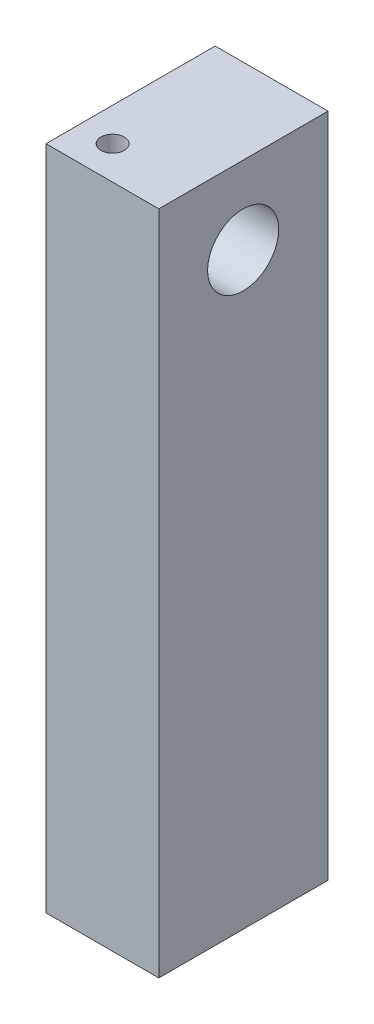
from build123d import *

# Parameters (mm, degrees)
SKETCH1_W           = 50.8
SKETCH1_H           = 76.2
BOSS_EXTRUDE1_DEPTH = 300
SKETCH2_R           = 16
CUT_EXTRUDE1_DEPTH  = 150
SKETCH4_R           = 5.25
CUT_EXTRUDE3_DEPTH  = 50


with BuildPart() as part:
    # Sketch1 → Boss-Extrude1 (new body)
    with BuildSketch(Plane(origin=(0, 0, 0), x_dir=(1, 0, 0), z_dir=(0, 1, 0))):
        with Locations((25.4, 38.1)):
            Rectangle(SKETCH1_W, SKETCH1_H)
    extrude(amount=BOSS_EXTRUDE1_DEPTH)

    # Sketch2 → Cut-Extrude1 (cut)
    with BuildSketch(Plane(origin=(50.8, 0, 0), x_dir=(0, 0, -1), z_dir=(1, 0, 0))):
        with Locations((38, 265)):
            Circle(SKETCH2_R)
    extrude(amount=-CUT_EXTRUDE1_DEPTH, mode=Mode.SUBTRACT)

    # Sketch4 → Cut-Extrude3 (cut)
    with BuildSketch(Plane(origin=(0, 300, 0), x_dir=(1, 0, 0), z_dir=(0, 1, 0))):
        with Locations((15, 15)):
            Circle(SKETCH4_R)
    extrude(amount=-CUT_EXTRUDE3_DEPTH, mode=Mode.SUBTRACT)


solid = part.part
